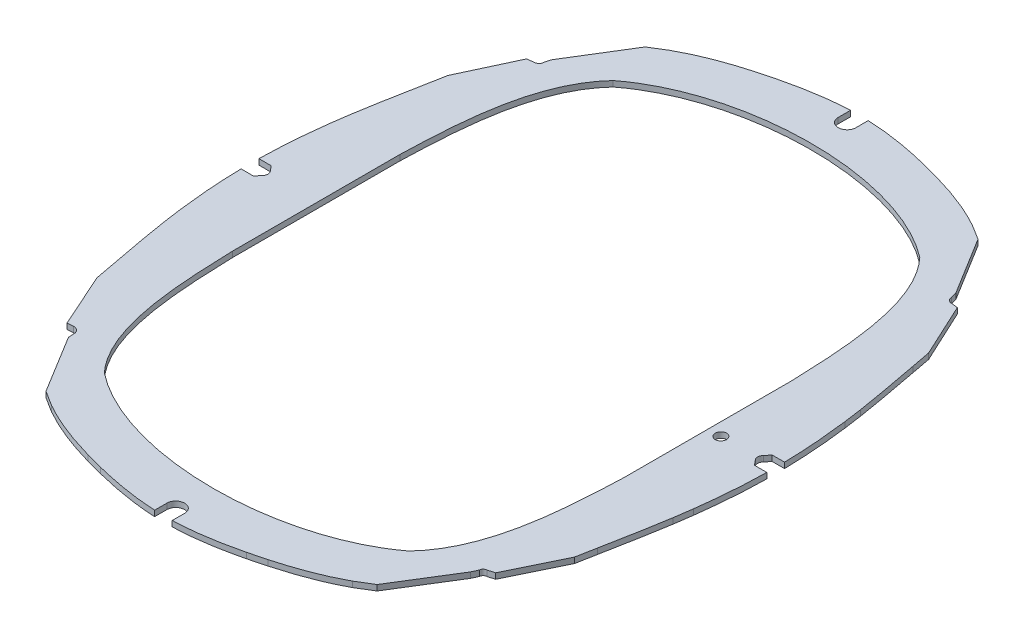
from build123d import *

# Parameters (mm, degrees)
SKETCH1_W           = 182.3
SKETCH1_H           = 252.579753384
BOSS_EXTRUDE1_DEPTH = 3.175
SKETCH2_W           = 207.7
SKETCH2_H           = 265.279753384
SKETCH2_W_2         = 182.3
SKETCH2_H_2         = 252.579753384
CUT_EXTRUDE1_DEPTH  = 3.175
BOSS_EXTRUDE2_START = -3.175
BOSS_EXTRUDE2_DEPTH = 3.175
BOSS_EXTRUDE3_DEPTH = 3.175
BOSS_EXTRUDE4_DEPTH = 3.175
CUT_EXTRUDE2_DEPTH  = 3.175
CUT_EXTRUDE6_DEPTH  = 3.175
SKETCH9_R           = 3.175
CUT_EXTRUDE8_DEPTH  = 3.175
BOSS_EXTRUDE5_START = -3.175
BOSS_EXTRUDE5_DEPTH = 3.175
CUT_EXTRUDE9_DEPTH  = 3.175


# Read off the part's stored shape, not the designer's step: Boss-Extrude2, Boss-Extrude5
with BuildPart() as part:
    # Sketch1 → Boss-Extrude1 (new body)
    with BuildSketch(Plane(origin=(0, 341.802855152, 0), x_dir=(-1, 0, 0), z_dir=(0, -1, 0))):
        Polygon((-107.5, 142.639876692), (-132.56321938, 0), (-107.5, -142.639876692), (0, -165.569938346), (107.5, -142.639876692), (132.56321938, 0), (107.5, 142.639876692), (0, 165.569938346), align=None)
        Rectangle(SKETCH1_W, SKETCH1_H, mode=Mode.SUBTRACT)
    extrude(amount=BOSS_EXTRUDE1_DEPTH)

    # Sketch2 → Cut-Extrude1 (cut)
    with BuildSketch(Plane.XZ.offset(-338.627855152)):
        Rectangle(SKETCH2_W, SKETCH2_H)
        Rectangle(SKETCH2_W_2, SKETCH2_H_2, mode=Mode.SUBTRACT)
    extrude(amount=-CUT_EXTRUDE1_DEPTH, mode=Mode.SUBTRACT)

    # Boss-Extrude2 outline → Boss-Extrude2 (add)
    with BuildSketch(Plane.XZ.offset(-338.627855152).offset(BOSS_EXTRUDE2_START)):
        with BuildLine():
            Line((-107.5, 142.639876692), (-114.418175504, 135.399543109))
            Line((-114.418175504, 135.399543109), (-114.645, 132.206339602))
            ThreePointArc((-114.645, 132.206339602), (-115.731241968, 129.527613835), (-118.461304342, 128.577743962))
            Line((-118.461304342, 128.577743962), (-121.871128861, 128.732198341))
            Line((-121.871128861, 128.732198341), (-132.56321938, 0))
            Line((-132.56321938, 0), (-107.5, 142.639876692))
        make_face()
        with BuildLine():
            Line((-107.5, -142.639876692), (-132.56321938, 0))
            Line((-132.56321938, 0), (-121.242476914, -129.324309875))
            Line((-121.242476914, -129.324309875), (-117.499802231, -129.784984413))
            ThreePointArc((-117.499802231, -129.784984413), (-115.481120377, -130.621168464), (-114.645, -132.639876692))
            Line((-114.645, -132.639876692), (-113.757127548, -135.955263416))
            Line((-113.757127548, -135.955263416), (-107.5, -142.639876692))
        make_face()
        with BuildLine():
            Line((132.56321938, 0), (120.611343371, 129.913671714))
            Line((120.611343371, 129.913671714), (116.852558376, 131.00118552))
            ThreePointArc((116.852558376, 131.00118552), (115.324743941, 131.614470283), (114.645, 133.113897948))
            Line((114.645, 133.113897948), (113.093773381, 136.508073995))
            Line((113.093773381, 136.508073995), (107.5, 142.639876692))
            Line((107.5, 142.639876692), (132.56321938, 0))
        make_face()
        with BuildLine():
            Line((121.24287361, -129.324352219), (132.56321938, 0))
            Line((132.56321938, 0), (107.5, -142.639876692))
            Line((107.5, -142.639876692), (113.757521928, -135.955303146))
            Line((113.757521928, -135.955303146), (114.645, -132.639876692))
            ThreePointArc((114.645, -132.639876692), (115.481250737, -130.620915306), (117.500197769, -129.784629913))
            Line((117.500197769, -129.784629913), (121.24287361, -129.324352219))
        make_face()
    extrude(amount=BOSS_EXTRUDE2_DEPTH)

    # Sketch4 → Boss-Extrude3 (add)
    with BuildSketch(Plane(origin=(0, 341.802855152, 0), x_dir=(1, 0, 0), z_dir=(0, 1, 0))):
        with BuildLine():
            Line((-107.5, 142.639876692), (-113.757127548, 135.955263416))
            Line((-113.757127548, 135.955263416), (-114.645, 132.639876692))
            ThreePointArc((-114.645, 132.639876692), (-115.481120377, 130.621168464), (-117.499802231, 129.784984413))
            Line((-117.499802231, 129.784984413), (-121.242476914, 129.324309875))
            Line((-121.242476914, 129.324309875), (-132.56321938, 0))
            Line((-132.56321938, 0), (-121.871128861, -128.732198341))
            Line((-121.871128861, -128.732198341), (-118.461304342, -128.577743962))
            ThreePointArc((-118.461304342, -128.577743962), (-115.731241967, -129.527613836), (-114.645, -132.206339602))
            Line((-114.645, -132.206339602), (-114.418175504, -135.399543109))
            Line((-114.418175504, -135.399543109), (-107.5, -142.639876692))
            Line((-107.5, -142.639876692), (0, -165.569938346))
            Line((0, -165.569938346), (107.5, -142.639876692))
            Line((107.5, -142.639876692), (113.093773381, -136.508073995))
            Line((113.093773381, -136.508073995), (114.645, -133.113897948))
            ThreePointArc((114.645, -133.113897948), (115.324743941, -131.614470283), (116.852558376, -131.00118552))
            Line((116.852558376, -131.00118552), (120.611343371, -129.913671714))
            Line((120.611343371, -129.913671714), (132.56321938, 0))
            Line((132.56321938, 0), (121.24287361, 129.324352219))
            Line((121.24287361, 129.324352219), (117.500197769, 129.784629913))
            ThreePointArc((117.500197769, 129.784629913), (115.481250737, 130.620915306), (114.645, 132.639876692))
            Line((114.645, 132.639876692), (113.757521928, 135.955303146))
            Line((113.757521928, 135.955303146), (107.5, 142.639876692))
            Line((107.5, 142.639876692), (0, 165.569938346))
            Line((0, 165.569938346), (-107.5, 142.639876692))
        make_face()
    extrude(amount=-BOSS_EXTRUDE3_DEPTH)

    # Sketch5 → Boss-Extrude4 (add)
    with BuildSketch(Plane.XZ.offset(-338.627855152)):
        with BuildLine():
            Line((0, 165.569938346), (104.631798642, 143.251672357))
            add(Edge.make_bspline(
                [(104.631798642, 143.251672357), (51.769673434, 183.754489591), (-0.893855299, 183.497891389)],
                knots=[0.037048239, 0.037048239, 0.037048239, 0.5, 0.5, 0.5], degree=2))
            add(Edge.make_bspline(
                [(-0.893855299, 183.497891389), (-52.907586837, 183.244459265), (-104.727592493, 143.231239251)],
                knots=[0.5, 0.5, 0.5, 0.957239559, 0.957239559, 0.957239559], degree=2))
            Line((-104.727592493, 143.231239251), (0, 165.569938346))
        make_face()
        with BuildLine():
            add(Edge.make_bspline(
                [(104.678252787, -143.241763553), (52.339217141, -183.499939751), (0.000188525, -183.499930472)],
                knots=[0.0399063, 0.0399063, 0.0399063, 0.500000002, 0.500000002, 0.500000002], degree=2))
            Line((104.678252787, -143.241763553), (0, -165.569938346))
            Line((0, -165.569938346), (-104.677644827, -143.241893233))
            add(Edge.make_bspline(
                [(0.000188525, -183.499930472), (-52.338731666, -183.499921193), (-104.677644827, -143.241893233)],
                knots=[0.500000002, 0.500000002, 0.500000002, 0.96009275, 0.96009275, 0.96009275], degree=2))
        make_face()
    extrude(amount=-BOSS_EXTRUDE4_DEPTH)

    # Sketch5<3> → Cut-Extrude2 (cut)
    with BuildSketch(Plane.XZ.offset(-338.627855152)):
        with BuildLine():
            add(Edge.make_bspline(
                [(-104.727592493, 143.231239251), (-109.573731137, 139.489255642), (-114.418175504, 135.399543109)],
                knots=[0.957239559, 0.957239559, 0.957239559, 1, 1, 1], degree=2))
            Line((-104.727592493, 143.231239251), (-107.5, 142.639876692))
            Line((-107.5, 142.639876692), (-114.418175504, 135.399543109))
        make_face()
        with BuildLine():
            add(Edge.make_bspline(
                [(113.093773381, 136.508073995), (108.862150087, 140.010388531), (104.631798642, 143.251672357)],
                knots=[0, 0, 0, 0.037048239, 0.037048239, 0.037048239], degree=2))
            Line((113.093773381, 136.508073995), (107.5, 142.639876692))
            Line((107.5, 142.639876692), (104.631798642, 143.251672357))
        make_face()
        with BuildLine():
            Line((107.5, -142.639876692), (113.757521928, -135.955303146))
            add(Edge.make_bspline(
                [(113.757521928, -135.955303146), (109.217887331, -139.749964266), (104.678252787, -143.241763553)],
                knots=[0, 0, 0, 0.0399063, 0.0399063, 0.0399063], degree=2))
            Line((104.678252787, -143.241763553), (107.5, -142.639876692))
        make_face()
        with BuildLine():
            Line((-107.5, -142.639876692), (-104.677644827, -143.241893233))
            add(Edge.make_bspline(
                [(-104.677644827, -143.241893233), (-109.217386214, -139.750016451), (-113.757127548, -135.955263416)],
                knots=[0.96009275, 0.96009275, 0.96009275, 1, 1, 1], degree=2))
            Line((-113.757127548, -135.955263416), (-107.5, -142.639876692))
        make_face()
    extrude(amount=-CUT_EXTRUDE2_DEPTH, mode=Mode.SUBTRACT)

    # Sketch8 → Cut-Extrude6 (cut)
    with BuildSketch(Plane(origin=(0, 341.802855152, 0), x_dir=(1, 0, 0), z_dir=(0, 1, 0))):
        with BuildLine():
            add(Edge.make_bspline(
                [(86.197142846, 143.243113761), (64.503683803, 159.943809006), (32.251936947, 168.274936104), (0.000191546, 168.274930472), (-32.304277599, 168.27492483), (-64.608745285, 159.916525451), (-86.303056846, 143.161111816)],
                knots=[0.908769556, 0.908769556, 0.908769556, 0.908769556, 1, 1, 1, 1.091379584, 1.091379584, 1.091379584, 1.091379584], degree=3))
            add(Edge.make_bspline(
                [(-86.303056846, 143.161111816), (-106.920235249, 121.282234989), (-109.216967613, 81.672068058), (-110.302807586, 47.07164998)],
                knots=[0.095183236, 0.095183236, 0.095183236, 0.095183236, 0.200106356, 0.200106356, 0.200106356, 0.200106356], degree=3))
            Line((-110.302807586, 47.07164998), (-110.302791146, -47.071827561))
            add(Edge.make_bspline(
                [(-110.302791146, -47.071827561), (-109.289262615, -81.431622118), (-107.284557625, -120.733247423), (-86.999243349, -142.617782044)],
                knots=[0.299840816, 0.299840816, 0.299840816, 0.299840816, 0.40402818, 0.40402818, 0.40402818, 0.40402818], degree=3))
            add(Edge.make_bspline(
                [(-86.999243349, -142.617782044), (-65.303522859, -159.735940675), (-0.744631262, -176.619407668), (63.814254506, -160.121078624), (85.497935282, -143.775901078)],
                knots=[0.407637679, 0.407637679, 0.407637679, 0.407637679, 0.5, 0.590255272, 0.590255272, 0.590255272, 0.590255272], degree=3))
            add(Edge.make_bspline(
                [(85.497935282, -143.775901078), (106.483767201, -121.907614728), (109.077783513, -81.947299221), (110.30324945, -47.071789037)],
                knots=[0.594340736, 0.594340736, 0.594340736, 0.594340736, 0.700104522, 0.700104522, 0.700104522, 0.700104522], degree=3))
            Line((110.30324945, -47.071789037), (110.30323301, 47.071688504))
            add(Edge.make_bspline(
                [(110.30323301, 47.071688504), (109.150815867, 81.70997129), (106.852790437, 121.36655451), (86.197142846, 143.243113761)],
                knots=[0.799838982, 0.799838982, 0.799838982, 0.799838982, 0.904873681, 0.904873681, 0.904873681, 0.904873681], degree=3))
        make_face()
    extrude(amount=-CUT_EXTRUDE6_DEPTH, mode=Mode.SUBTRACT)

    # Sketch9 → Cut-Extrude8 (cut)
    with BuildSketch(Plane.XZ.offset(-338.627855152)):
        with Locations(Location((117.475220932, 4.9014e-05, 0), (0, 0, 270))):
            Circle(SKETCH9_R)
    extrude(amount=-CUT_EXTRUDE8_DEPTH, mode=Mode.SUBTRACT)

    # Boss-Extrude5 outline → Boss-Extrude5 (add)
    with BuildSketch(Plane.XZ.offset(-338.627855152).offset(BOSS_EXTRUDE5_START)):
        with BuildLine():
            Line((-145.187398918, -42.256354034), (-143.767324042, -52.313536429))
            add(Edge.make_bspline(
                [(-143.767324042, -52.313536429), (-142.985840605, -57.401548051), (-142.119169753, -62.476955511), (-140.177295221, -73.27926012), (-139.089911626, -79.004355154), (-137.776172802, -85.945096072), (-137.546821743, -87.1602987), (-137.317976708, -88.375576199)],
                knots=[0.298686358, 0.298686358, 0.298686358, 0.298686358, 0.3125, 0.3125, 0.328125, 0.328125, 0.331440974, 0.331440974, 0.331440974, 0.331440974], degree=3))
            Line((-137.317976708, -88.375576199), (-135.287043072, -99.115615345))
            add(Edge.make_bspline(
                [(-135.287043072, -99.115615345), (-135.105885933, -100.045478329), (-134.9219433, -100.974929175), (-133.57836028, -107.61878216), (-132.277673381, -113.312315188), (-130.135046866, -120.352770971), (-129.682130631, -121.751274864), (-128.723116139, -124.518567573), (-128.2166717, -125.88850399), (-126.840422777, -129.363253591), (-125.926949473, -131.445841117), (-124.928344467, -133.485100066)],
                knots=[0.34121042, 0.34121042, 0.34121042, 0.34121042, 0.34375, 0.34375, 0.359375, 0.359375, 0.36328125, 0.36328125, 0.3671875, 0.3671875, 0.373301175, 0.373301175, 0.373301175, 0.373301175], degree=3))
            Line((-124.928344467, -133.485100066), (-121.242476914, -129.324309875))
            Line((-121.242476914, -129.324309875), (-132.56321938, 0))
            Line((-132.56321938, 0), (-121.871128861, 128.732198341))
            Line((-121.871128861, 128.732198341), (-125.346697486, 132.617290795))
            add(Edge.make_bspline(
                [(-125.346697486, 132.617290795), (-125.604869452, 132.074379681), (-125.857109578, 131.528571638), (-127.292068316, 128.333823178), (-128.348283859, 125.623102568), (-129.772067532, 121.47861905), (-130.219930556, 120.084069688), (-131.068860354, 117.272117122), (-131.469119573, 115.857193994), (-132.603909857, 111.609634589), (-133.275219562, 108.765639175), (-134.44914614, 103.362008524), (-134.961948819, 100.803842181), (-135.456236378, 98.243005777)],
                knots=[0.13119265, 0.13119265, 0.13119265, 0.13119265, 0.1328125, 0.1328125, 0.140625, 0.140625, 0.14453125, 0.14453125, 0.1484375, 0.1484375, 0.15625, 0.15625, 0.163242446, 0.163242446, 0.163242446, 0.163242446], degree=3))
            Line((-135.456236378, 98.243005777), (-137.47812906, 87.522677157))
            add(Edge.make_bspline(
                [(-137.47812906, 87.522677157), (-138.481698398, 82.206936498), (-139.496750526, 76.892851771), (-141.529019156, 65.843850611), (-142.540095155, 60.108048656), (-143.595723779, 53.427980037), (-143.73994025, 52.498085885), (-143.88124765, 51.567772216)],
                knots=[0.172993805, 0.172993805, 0.172993805, 0.172993805, 0.1875, 0.1875, 0.203125, 0.203125, 0.205650594, 0.205650594, 0.205650594, 0.205650594], degree=3))
            Line((-143.88124765, 51.567772216), (-145.282540045, 41.513520022))
            add(Edge.make_bspline(
                [(-145.282540045, 41.513520022), (-145.469855995, 40.0283904), (-145.648367084, 38.541991024), (-147.040184711, 26.322533088), (-147.794459934, 15.523277384), (-147.963533291, 4.639629418)],
                knots=[0.214732864, 0.214732864, 0.214732864, 0.214732864, 0.21875, 0.21875, 0.247728112, 0.247728112, 0.247728112, 0.247728112], degree=3))
            Line((-147.963533291, 4.639629418), (-141.011959602, 4.656564326))
            Line((-141.011959602, 4.656564326), (-138.760346747, 1.906949159))
            ThreePointArc((-138.760346747, 1.906949159), (-137.82500942, -0.335686776), (-138.749409131, -2.582853219))
            Line((-138.749409131, -2.582853219), (-140.987598655, -5.343406002))
            Line((-140.987598655, -5.343406002), (-147.951207687, -5.360370063))
            add(Edge.make_bspline(
                [(-147.951207687, -5.360370063), (-147.942966504, -5.819262881), (-147.93368562, -6.27800187), (-147.857428149, -9.669819727), (-147.749379845, -12.596821827), (-147.306455237, -21.360254072), (-146.852978845, -27.179136736), (-145.94136799, -36.076126584), (-145.58311703, -39.169012036), (-145.187398918, -42.256354034)],
                knots=[0.25659108, 0.25659108, 0.25659108, 0.25659108, 0.2578125, 0.2578125, 0.265625, 0.265625, 0.28125, 0.28125, 0.289601127, 0.289601127, 0.289601127, 0.289601127], degree=3))
        make_face()
        with BuildLine():
            Line((-93.709746683, -168.498034842), (-85.185434756, -173.777151664))
            add(Edge.make_bspline(
                [(-85.185434756, -173.777151664), (-80.929872562, -176.151772979), (-76.548456196, -178.239395309), (-66.703278534, -182.336045199), (-61.196701682, -184.24743578), (-54.197563448, -186.37233545), (-52.79079398, -186.784441157), (-51.25136145, -187.221352234), (-51.120625054, -187.258346596), (-50.989876397, -187.29523582)],
                knots=[0.424455575, 0.424455575, 0.424455575, 0.424455575, 0.4375, 0.4375, 0.453125, 0.453125, 0.45703125, 0.45703125, 0.457393738, 0.457393738, 0.457393738, 0.457393738], degree=3))
            Line((-50.989876397, -187.29523582), (-41.319143158, -189.846490256))
            add(Edge.make_bspline(
                [(-41.319143158, -189.846490256), (-40.436264925, -190.063587471), (-39.552866575, -190.276224571), (-33.0029697, -191.816569017), (-27.314159943, -192.95295265), (-16.095191768, -194.627224134), (-10.56763007, -195.187379417), (-4.999812797, -195.402334311)],
                knots=[0.466312318, 0.466312318, 0.466312318, 0.466312318, 0.46875, 0.46875, 0.484375, 0.484375, 0.499386832, 0.499386832, 0.499386832, 0.499386832], degree=3))
            Line((-4.999812797, -195.402334311), (-4.999811986, -188.499929599))
            ThreePointArc((-4.999811986, -188.499929599), (-3.535345355, -184.964396029), (0.00018866, -183.499930472))
            add(Edge.make_bspline(
                [(0.00018866, -183.499930472), (-56.878473595, -183.499920444), (-113.757127548, -135.955263416)],
                knots=[0.500000001, 0.500000001, 0.500000001, 1, 1, 1], degree=2))
            Line((-113.757127548, -135.955263416), (-119.667290206, -142.626948271))
            add(Edge.make_bspline(
                [(-119.667290206, -142.626948271), (-119.655626227, -142.64445136), (-119.643955097, -142.661950811), (-118.821311429, -143.894394634), (-117.9758757, -145.091798652), (-116.2174934, -147.45224643), (-115.303131634, -148.616661769), (-112.494054568, -152.019825205), (-110.523979042, -154.182596887), (-106.40748009, -158.316130633), (-104.260990116, -160.286820239), (-99.801079139, -164.046443033), (-97.487646762, -165.835363835), (-94.634267303, -167.858776689), (-94.173437923, -168.180110106), (-93.709746683, -168.498034842)],
                knots=[0.382756248, 0.382756248, 0.382756248, 0.382756248, 0.3828125, 0.3828125, 0.38671875, 0.38671875, 0.390625, 0.390625, 0.3984375, 0.3984375, 0.40625, 0.40625, 0.4140625, 0.4140625, 0.415553963, 0.415553963, 0.415553963, 0.415553963], degree=3))
        make_face()
        with BuildLine():
            add(Edge.make_bspline(
                [(113.757521928, -135.955303146), (56.878851143, -183.499940499), (0.00018866, -183.499930472)],
                knots=[0, 0, 0, 0.500000001, 0.500000001, 0.500000001], degree=2))
            ThreePointArc((0.00018866, -183.499930472), (3.535722457, -184.964397103), (5.000188014, -188.499931345))
            Line((5.000188014, -188.499931345), (5.000186809, -195.402340252))
            add(Edge.make_bspline(
                [(5.000186809, -195.402340252), (7.728918018, -195.296948639), (10.467433012, -195.107658334), (14.686798733, -194.699539764), (16.161084812, -194.535160041), (19.094482657, -194.167812162), (20.556226219, -193.964612727), (24.927866342, -193.301463862), (27.824189997, -192.788033424), (34.264544051, -191.508701782), (37.800911382, -190.712605966), (41.319698738, -189.847240192)],
                knots=[0.508333814, 0.508333814, 0.508333814, 0.508333814, 0.515625, 0.515625, 0.51953125, 0.51953125, 0.5234375, 0.5234375, 0.53125, 0.53125, 0.54089979, 0.54089979, 0.54089979, 0.54089979], degree=3))
            Line((41.319698738, -189.847240192), (50.990269224, -187.295311025))
            add(Edge.make_bspline(
                [(50.990269224, -187.295311025), (55.589660898, -185.99778453), (60.157240157, -184.57490746), (66.062613891, -182.460435924), (67.445189157, -181.945291365), (70.199893909, -180.873842711), (71.573891331, -180.31673504), (75.664090364, -178.583148216), (78.343389232, -177.346766376), (82.390499219, -175.298861923), (83.79658585, -174.552332308), (85.185803452, -173.777158561)],
                knots=[0.549777786, 0.549777786, 0.549777786, 0.549777786, 0.5625, 0.5625, 0.56640625, 0.56640625, 0.5703125, 0.5703125, 0.578125, 0.578125, 0.582356867, 0.582356867, 0.582356867, 0.582356867], degree=3))
            Line((85.185803452, -173.777158561), (93.710148308, -168.498103183))
            add(Edge.make_bspline(
                [(93.710148308, -168.498103183), (94.487588011, -167.96505097), (95.25867401, -167.421210005), (97.217066647, -166.000495632), (98.395144319, -165.107951204), (100.719071919, -163.268138816), (101.86572314, -162.319955783), (105.223591372, -159.418525646), (107.36391782, -157.400328443), (111.442022377, -153.190951739), (113.379831318, -150.99979857), (116.777794863, -146.756756377), (118.266753507, -144.729466859), (119.667696432, -142.627009304)],
                knots=[0.591247736, 0.591247736, 0.591247736, 0.591247736, 0.59375, 0.59375, 0.59765625, 0.59765625, 0.6015625, 0.6015625, 0.609375, 0.609375, 0.6171875, 0.6171875, 0.623888494, 0.623888494, 0.623888494, 0.623888494], degree=3))
            Line((119.667696432, -142.627009304), (113.757521928, -135.955303146))
        make_face()
        with BuildLine():
            Line((141.012403091, 4.656515076), (147.963455467, 4.639579177))
            add(Edge.make_bspline(
                [(147.963455467, 4.639579177), (147.91649625, 7.660458221), (147.824350215, 10.685373527), (147.422672373, 19.63163718), (146.991021094, 25.563893711), (146.114347646, 34.482751229), (145.783794173, 37.459202561), (145.312514725, 41.285141953), (145.203774476, 42.143136956), (145.092132899, 43.000652883)],
                knots=[0.757627359, 0.757627359, 0.757627359, 0.757627359, 0.765625, 0.765625, 0.78125, 0.78125, 0.7890625, 0.7890625, 0.791322671, 0.791322671, 0.791322671, 0.791322671], degree=3))
            Line((145.092132899, 43.000652883), (143.652403224, 53.060554942))
            add(Edge.make_bspline(
                [(143.652403224, 53.060554942), (142.929624996, 57.71613458), (142.137378021, 62.360243848), (140.253278817, 72.879682717), (139.138342491, 78.751200773), (137.736066479, 86.159431058), (137.446333563, 87.69575382), (137.15732152, 89.232192274)],
                knots=[0.800179502, 0.800179502, 0.800179502, 0.800179502, 0.8125, 0.8125, 0.828125, 0.828125, 0.832212522, 0.832212522, 0.832212522, 0.832212522], degree=3))
            Line((137.15732152, 89.232192274), (135.116002095, 99.991342431))
            add(Edge.make_bspline(
                [(135.116002095, 99.991342431), (134.968981565, 100.738112496), (134.819988705, 101.484327739), (133.479604536, 108.078862945), (132.135409551, 113.884198765), (129.489509896, 122.415092058), (128.502595454, 125.229200992), (126.811916178, 129.391204213), (126.213265307, 130.768667382), (125.255537182, 132.818053765), (124.926454933, 133.498011215), (124.559606006, 134.229429967), (124.529998173, 134.288279426), (124.500323206, 134.347080069)],
                knots=[0.84175848, 0.84175848, 0.84175848, 0.84175848, 0.84375, 0.84375, 0.859375, 0.859375, 0.8671875, 0.8671875, 0.87109375, 0.87109375, 0.873046875, 0.873046875, 0.873217926, 0.873217926, 0.873217926, 0.873217926], degree=3))
            Line((124.500323206, 134.347080069), (120.611343371, 129.913671714))
            Line((120.611343371, 129.913671714), (132.56321938, 0))
            Line((132.56321938, 0), (121.24287361, -129.324352219))
            Line((121.24287361, -129.324352219), (124.928772838, -133.48518108))
            add(Edge.make_bspline(
                [(124.928772838, -133.48518108), (126.17224492, -130.945966441), (127.275705179, -128.35618238), (130.34103399, -120.220412508), (131.922523464, -114.537041509), (133.998634776, -105.554749508), (134.659872568, -102.336789876), (135.287399475, -99.115627639)],
                knots=[0.633159633, 0.633159633, 0.633159633, 0.633159633, 0.640625, 0.640625, 0.65625, 0.65625, 0.664937565, 0.664937565, 0.664937565, 0.664937565], degree=3))
            Line((135.287399475, -99.115627639), (137.318097851, -88.37542481))
            add(Edge.make_bspline(
                [(137.318097851, -88.37542481), (138.221228037, -83.585959309), (139.135251501, -78.797466815), (141.103254047, -68.209418075), (142.145402275, -62.408805076), (143.321981974, -55.171390688), (143.548246221, -53.742791957), (143.767740103, -52.313588485)],
                knots=[0.67458861, 0.67458861, 0.67458861, 0.67458861, 0.6875, 0.6875, 0.703125, 0.703125, 0.70696599, 0.70696599, 0.70696599, 0.70696599], degree=3))
            Line((143.767740103, -52.313588485), (145.18844821, -42.256608364))
            add(Edge.make_bspline(
                [(145.18844821, -42.256608364), (145.321522745, -41.218229991), (145.45028549, -40.179466449), (146.916098098, -27.929393731), (147.748880626, -16.673038812), (147.951836328, -5.360422033)],
                knots=[0.715965605, 0.715965605, 0.715965605, 0.715965605, 0.71875, 0.71875, 0.748789327, 0.748789327, 0.748789327, 0.748789327], degree=3))
            Line((147.951836328, -5.360422033), (140.988038652, -5.343455242))
            Line((140.988038652, -5.343455242), (138.755127417, -2.588818154))
            ThreePointArc((138.755127417, -2.588818154), (137.824999244, -0.343024188), (138.755758132, 1.902508455))
            Line((138.755758132, 1.902508455), (141.012403091, 4.656515076))
        make_face()
        with BuildLine():
            Line((92.927585935, 169.029301592), (84.360410832, 174.23343367))
            add(Edge.make_bspline(
                [(84.360410832, 174.23343367), (83.525022426, 174.690610611), (82.68311629, 175.137966968), (80.503051072, 176.263271137), (79.159681748, 176.925040677), (75.104912009, 178.835873014), (72.368867816, 180.010513864), (64.078854642, 183.287164524), (58.443102637, 185.142197099), (51.854915035, 187.051636008), (50.967866365, 187.303504867), (50.079353667, 187.550952497)],
                knots=[0.923305786, 0.923305786, 0.923305786, 0.923305786, 0.92578125, 0.92578125, 0.9296875, 0.9296875, 0.9375, 0.9375, 0.953125, 0.953125, 0.955551121, 0.955551121, 0.955551121, 0.955551121], degree=3))
            Line((50.079353667, 187.550952497), (40.40012846, 190.071021703))
            add(Edge.make_bspline(
                [(40.40012846, 190.071021703), (38.756955439, 190.469119524), (37.108791175, 190.852144157), (32.543172062, 191.861962702), (29.610142788, 192.453107923), (23.735194561, 193.497488016), (20.790350608, 193.951511571), (14.883296339, 194.698930487), (11.921088293, 194.992346846), (7.462666227, 195.292713187), (5.974005764, 195.369528938), (4.337797433, 195.426364074), (4.192928221, 195.431159381), (4.048033323, 195.435717105)],
                knots=[0.964312519, 0.964312519, 0.964312519, 0.964312519, 0.96875, 0.96875, 0.9765625, 0.9765625, 0.984375, 0.984375, 0.9921875, 0.9921875, 0.99609375, 0.99609375, 0.996473131, 0.996473131, 0.996473131, 0.996473131], degree=3))
            Line((4.048033323, 195.435717105), (4.081723704, 188.522193787))
            ThreePointArc((4.081723704, 188.522193787), (2.634501386, 184.979566494), (-0.893855096, 183.497891391))
            add(Edge.make_bspline(
                [(113.093773381, 136.508073995), (55.984132074, 183.775024068), (-0.893855096, 183.497891391)],
                knots=[0, 0, 0, 0.5, 0.5, 0.5], degree=2))
            Line((113.093773381, 136.508073995), (119.143329401, 143.404523264))
            add(Edge.make_bspline(
                [(119.143329401, 143.404523264), (119.056189688, 143.532154255), (118.968706007, 143.659535126), (117.192756373, 146.230323333), (115.378241575, 148.58207346), (111.515104122, 153.11534072), (109.464896204, 155.298323898), (105.145100054, 159.494082693), (102.903850436, 161.47978846), (98.11872944, 165.367622261), (95.564738442, 167.255796599), (92.927585935, 169.029301592)],
                knots=[0.882406051, 0.882406051, 0.882406051, 0.882406051, 0.8828125, 0.8828125, 0.890625, 0.890625, 0.8984375, 0.8984375, 0.90625, 0.90625, 0.914576088, 0.914576088, 0.914576088, 0.914576088], degree=3))
        make_face()
        with BuildLine():
            add(Edge.make_bspline(
                [(-0.893855096, 183.49789139), (-57.771842369, 183.220758712), (-114.418175504, 135.399543109)],
                knots=[0.5, 0.5, 0.5, 1, 1, 1], degree=2))
            ThreePointArc((-0.893855096, 183.49789139), (-4.436482492, 184.945113708), (-5.918157597, 188.473470292))
            Line((-5.918157597, 188.473470292), (-5.951724428, 195.362638076))
            add(Edge.make_bspline(
                [(-5.951724428, 195.362638076), (-9.834597452, 195.185417502), (-13.688267564, 194.842252879), (-23.297821026, 193.645408038), (-29.023471498, 192.619931041), (-37.227189612, 190.833144787), (-39.735438733, 190.243340239), (-42.237623192, 189.619073559)],
                knots=[0.005270105, 0.005270105, 0.005270105, 0.005270105, 0.015625, 0.015625, 0.03125, 0.03125, 0.038160326, 0.038160326, 0.038160326, 0.038160326], degree=3))
            Line((-42.237623192, 189.619073559), (-51.899860345, 187.036922403))
            add(Edge.make_bspline(
                [(-51.899860345, 187.036922403), (-53.231221273, 186.656062674), (-54.56062278, 186.264068684), (-57.289051373, 185.431676899), (-58.687989706, 184.989701815), (-62.860125599, 183.619754473), (-65.613568484, 182.646270979), (-73.771156753, 179.504833117), (-79.072499169, 177.115756758), (-84.797061019, 173.995386177), (-85.403323536, 173.657804819), (-86.006872735, 173.314387305)],
                knots=[0.047081734, 0.047081734, 0.047081734, 0.047081734, 0.05078125, 0.05078125, 0.0546875, 0.0546875, 0.0625, 0.0625, 0.078125, 0.078125, 0.079984799, 0.079984799, 0.079984799, 0.079984799], degree=3))
            Line((-86.006872735, 173.314387305), (-94.487445199, 167.959922807))
            add(Edge.make_bspline(
                [(-94.487445199, 167.959922807), (-94.77992892, 167.755555885), (-95.071242451, 167.549823589), (-96.557323414, 166.489042529), (-97.732339529, 165.612937121), (-101.194165565, 162.917771083), (-103.417990175, 161.032111235), (-107.692106358, 157.0773017), (-109.742432298, 155.008188352), (-112.677719132, 151.756271881), (-113.632715673, 150.64752284), (-115.028129843, 148.945191061), (-115.487082703, 148.37120705), (-116.392229665, 147.209748212), (-116.839092541, 146.621353037), (-118.292246266, 144.656353574), (-119.261233567, 143.261538358), (-120.183042995, 141.843682956)],
                knots=[0.088896775, 0.088896775, 0.088896775, 0.088896775, 0.08984375, 0.08984375, 0.09375, 0.09375, 0.1015625, 0.1015625, 0.109375, 0.109375, 0.11328125, 0.11328125, 0.115234375, 0.115234375, 0.1171875, 0.1171875, 0.121710621, 0.121710621, 0.121710621, 0.121710621], degree=3))
            Line((-120.183042995, 141.843682956), (-114.418175504, 135.399543109))
        make_face()
    extrude(amount=BOSS_EXTRUDE5_DEPTH)

    # Sketch11 → Cut-Extrude9 (cut)
    with BuildSketch(Plane.XZ.offset(-338.627855152)):
        with BuildLine():
            Line((120.611343371, 129.913671714), (135.116002095, 99.991342431))
            add(Edge.make_bspline(
                [(135.116002095, 99.991342431), (134.968981565, 100.738112496), (134.819988705, 101.484327739), (133.479604536, 108.078862945), (132.135409551, 113.884198765), (129.489509896, 122.415092058), (128.502595454, 125.229200992), (126.811916178, 129.391204213), (126.213265307, 130.768667382), (125.255537182, 132.818053765), (124.926454933, 133.498011215), (124.559606006, 134.229429967), (124.529998173, 134.288279426), (124.500323206, 134.347080069)],
                knots=[0.84175848, 0.84175848, 0.84175848, 0.84175848, 0.84375, 0.84375, 0.859375, 0.859375, 0.8671875, 0.8671875, 0.87109375, 0.87109375, 0.873046875, 0.873046875, 0.873217926, 0.873217926, 0.873217926, 0.873217926], degree=3))
            Line((124.500323206, 134.347080069), (120.611343371, 129.913671714))
        make_face()
        with BuildLine():
            Line((113.093773381, 136.508073995), (119.143329401, 143.404523264))
            add(Edge.make_bspline(
                [(119.143329401, 143.404523264), (119.056189688, 143.532154255), (118.968706007, 143.659535126), (117.192756373, 146.230323333), (115.378241575, 148.58207346), (111.515104122, 153.11534072), (109.464896204, 155.298323898), (105.145100054, 159.494082693), (102.903850436, 161.47978846), (98.11872944, 165.367622261), (95.564738442, 167.255796599), (92.927585935, 169.029301592)],
                knots=[0.882406051, 0.882406051, 0.882406051, 0.882406051, 0.8828125, 0.8828125, 0.890625, 0.890625, 0.8984375, 0.8984375, 0.90625, 0.90625, 0.914576088, 0.914576088, 0.914576088, 0.914576088], degree=3))
            Line((92.927585935, 169.029301592), (113.093773381, 136.508073995))
        make_face()
        with BuildLine():
            Line((-121.871128861, 128.732198341), (-125.346697486, 132.617290795))
            add(Edge.make_bspline(
                [(-125.346697486, 132.617290795), (-125.604869452, 132.074379681), (-125.857109578, 131.528571638), (-127.292068316, 128.333823178), (-128.348283859, 125.623102568), (-129.772067532, 121.47861905), (-130.219930556, 120.084069688), (-131.068860354, 117.272117122), (-131.469119573, 115.857193994), (-132.603909857, 111.609634589), (-133.275219562, 108.765639175), (-134.44914614, 103.362008524), (-134.961948819, 100.803842181), (-135.456236378, 98.243005777)],
                knots=[0.13119265, 0.13119265, 0.13119265, 0.13119265, 0.1328125, 0.1328125, 0.140625, 0.140625, 0.14453125, 0.14453125, 0.1484375, 0.1484375, 0.15625, 0.15625, 0.163242446, 0.163242446, 0.163242446, 0.163242446], degree=3))
            Line((-135.456236378, 98.243005777), (-121.871128861, 128.732198341))
        make_face()
        with BuildLine():
            Line((-114.418175504, 135.399543109), (-94.487445199, 167.959922807))
            add(Edge.make_bspline(
                [(-94.487445199, 167.959922807), (-94.77992892, 167.755555885), (-95.071242451, 167.549823589), (-96.557323414, 166.489042529), (-97.732339529, 165.612937121), (-101.194165565, 162.917771083), (-103.417990175, 161.032111235), (-107.692106358, 157.0773017), (-109.742432298, 155.008188352), (-112.677719132, 151.756271881), (-113.632715673, 150.64752284), (-115.028129843, 148.945191061), (-115.487082703, 148.37120705), (-116.392229665, 147.209748212), (-116.839092541, 146.621353037), (-118.292246266, 144.656353574), (-119.261233567, 143.261538358), (-120.183042995, 141.843682956)],
                knots=[0.088896775, 0.088896775, 0.088896775, 0.088896775, 0.08984375, 0.08984375, 0.09375, 0.09375, 0.1015625, 0.1015625, 0.109375, 0.109375, 0.11328125, 0.11328125, 0.115234375, 0.115234375, 0.1171875, 0.1171875, 0.121710621, 0.121710621, 0.121710621, 0.121710621], degree=3))
            Line((-120.183042995, 141.843682956), (-114.418175504, 135.399543109))
        make_face()
        with BuildLine():
            Line((-121.242476914, -129.324309875), (-135.287043072, -99.115615345))
            add(Edge.make_bspline(
                [(-135.287043072, -99.115615345), (-135.105885933, -100.045478329), (-134.9219433, -100.974929175), (-133.57836028, -107.61878216), (-132.277673381, -113.312315188), (-130.135046866, -120.352770971), (-129.682130631, -121.751274864), (-128.723116139, -124.518567573), (-128.2166717, -125.88850399), (-126.840422777, -129.363253591), (-125.926949473, -131.445841117), (-124.928344467, -133.485100066)],
                knots=[0.34121042, 0.34121042, 0.34121042, 0.34121042, 0.34375, 0.34375, 0.359375, 0.359375, 0.36328125, 0.36328125, 0.3671875, 0.3671875, 0.373301175, 0.373301175, 0.373301175, 0.373301175], degree=3))
            Line((-124.928344467, -133.485100066), (-121.242476914, -129.324309875))
        make_face()
        with BuildLine():
            Line((-113.757127548, -135.955263416), (-119.667290206, -142.626948271))
            add(Edge.make_bspline(
                [(-119.667290206, -142.626948271), (-119.655626227, -142.64445136), (-119.643955097, -142.661950811), (-118.821311429, -143.894394634), (-117.9758757, -145.091798652), (-116.2174934, -147.45224643), (-115.303131634, -148.616661769), (-112.494054568, -152.019825205), (-110.523979042, -154.182596887), (-106.40748009, -158.316130633), (-104.260990116, -160.286820239), (-99.801079139, -164.046443033), (-97.487646762, -165.835363835), (-94.634267303, -167.858776689), (-94.173437923, -168.180110106), (-93.709746683, -168.498034842)],
                knots=[0.382756248, 0.382756248, 0.382756248, 0.382756248, 0.3828125, 0.3828125, 0.38671875, 0.38671875, 0.390625, 0.390625, 0.3984375, 0.3984375, 0.40625, 0.40625, 0.4140625, 0.4140625, 0.415553963, 0.415553963, 0.415553963, 0.415553963], degree=3))
            Line((-93.709746683, -168.498034842), (-113.757127548, -135.955263416))
        make_face()
        with BuildLine():
            Line((113.757521928, -135.955303146), (93.710148308, -168.498103183))
            add(Edge.make_bspline(
                [(93.710148308, -168.498103183), (94.487588011, -167.96505097), (95.25867401, -167.421210005), (97.217066647, -166.000495632), (98.395144319, -165.107951204), (100.719071919, -163.268138816), (101.86572314, -162.319955783), (105.223591372, -159.418525646), (107.36391782, -157.400328443), (111.442022377, -153.190951739), (113.379831318, -150.99979857), (116.777794863, -146.756756377), (118.266753507, -144.729466859), (119.667696432, -142.627009304)],
                knots=[0.591247736, 0.591247736, 0.591247736, 0.591247736, 0.59375, 0.59375, 0.59765625, 0.59765625, 0.6015625, 0.6015625, 0.609375, 0.609375, 0.6171875, 0.6171875, 0.623888494, 0.623888494, 0.623888494, 0.623888494], degree=3))
            Line((119.667696432, -142.627009304), (113.757521928, -135.955303146))
        make_face()
        with BuildLine():
            Line((121.24287361, -129.324352219), (124.928772838, -133.48518108))
            add(Edge.make_bspline(
                [(124.928772838, -133.48518108), (126.17224492, -130.945966441), (127.275705179, -128.35618238), (130.34103399, -120.220412508), (131.922523464, -114.537041509), (133.998634776, -105.554749508), (134.659872568, -102.336789876), (135.287399475, -99.115627639)],
                knots=[0.633159633, 0.633159633, 0.633159633, 0.633159633, 0.640625, 0.640625, 0.65625, 0.65625, 0.664937565, 0.664937565, 0.664937565, 0.664937565], degree=3))
            Line((135.287399475, -99.115627639), (121.24287361, -129.324352219))
        make_face()
    extrude(amount=-CUT_EXTRUDE9_DEPTH, mode=Mode.SUBTRACT)


solid = part.part
